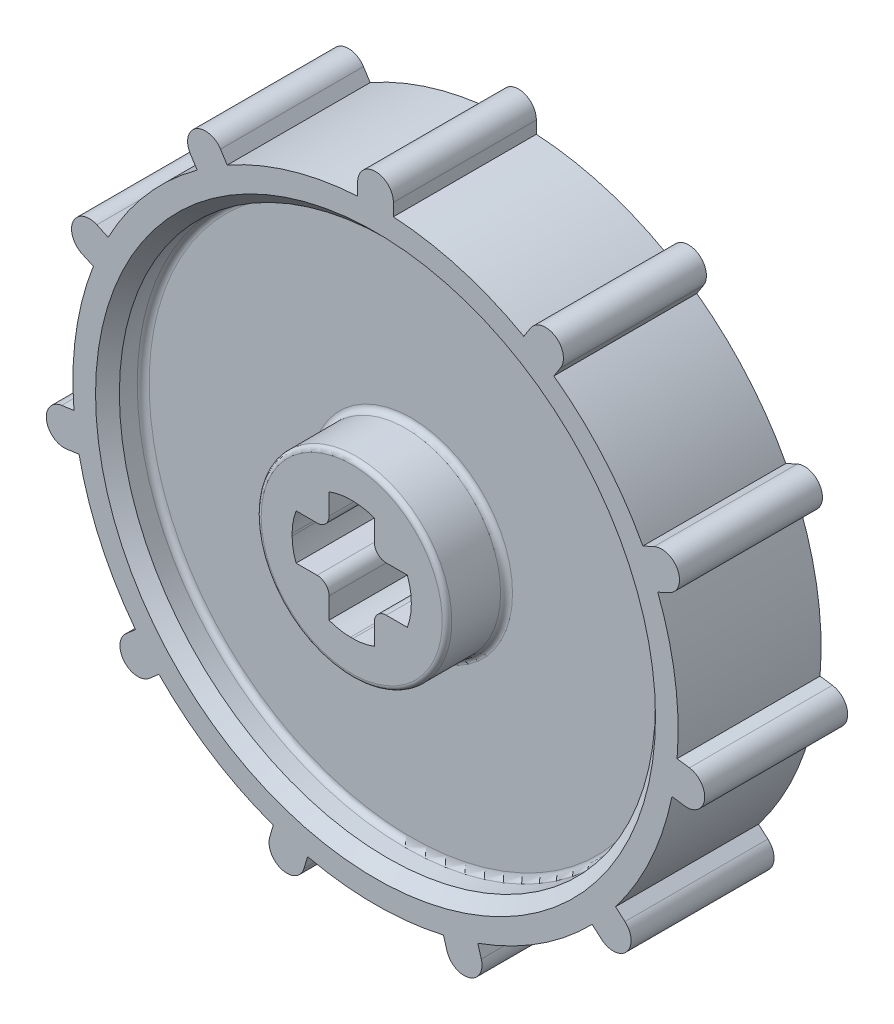
from build123d import *

# Parameters (mm, degrees)
BOSS_EXTRUDE1_DEPTH = 7
CIRPATTERN1_COUNT   = 11
CUT_EXTRUDE1_DEPTH  = 5
SKETCH4_R           = 11.25
SKETCH4_R_2         = 4
CUT_EXTRUDE2_DEPTH  = 2.5
CUT_EXTRUDE3_START  = -1
SKETCH6_R           = 11.25
CUT_EXTRUDE3_DEPTH  = 1
CHAMFER1_SIZE       = 0.5
FILLET1_R           = 0.25
FILLET2_R           = 0.2
CHAMFER2_SIZE       = 0.5
CHAMFER2_SIZE_2     = 1.866025404


with BuildPart() as part:
    # Sketch1 → Revolve1 (revolve)
    with BuildSketch(Plane(origin=(0, 0, 0), x_dir=(0, 0, -1), z_dir=(1, 0, 0)), mode=Mode.PRIVATE) as revolve1_sk:
        Polygon((0, 12.7), (7, 12.7), (7, 11.7), (6.5, 11.7), (6.5, 0), (0, 0), align=None)
    revolve(revolve1_sk.sketch.rotate(Axis((0, 0, 9.434023018), (0, 0, -1)), 90), axis=Axis((0, 0, 9.434023018), (0, 0, -1)))

    # Sketch2 → Boss-Extrude1 (add)
    with BuildSketch(Plane.XY):
        with BuildLine():
            Line((-0.75, 12.677834989), (-0.75, 13.2))
            ThreePointArc((-0.75, 13.2), (0, 13.95), (0.75, 13.2))
            Line((0.75, 13.2), (0.75, 12.677834989))
            ThreePointArc((0.75, 12.677834989), (0, 11.927834989), (-0.75, 12.677834989))
        make_face()
    boss_extrude1 = extrude(amount=-BOSS_EXTRUDE1_DEPTH)

    # CirPattern1: Boss-Extrude1 ×11 about axis
    cirpattern1_axis = Axis((0, 0, 0), (0, 0, 1))
    for i in range(1, CIRPATTERN1_COUNT):
        add(boss_extrude1.rotate(cirpattern1_axis, i * 360 / CIRPATTERN1_COUNT))

    # Sketch3 → Cut-Extrude1 (cut)
    with BuildSketch(Plane.XY):
        with BuildLine():
            Line((-0.95, 2.332380758), (-0.95, 1.45))
            ThreePointArc((-0.95, 1.45), (-1.096446609, 1.096446609), (-1.45, 0.95))
            Line((-1.45, 0.95), (-2.332380758, 0.95))
            ThreePointArc((-2.332380758, 0.95), (-2.457737974, 0.507737974), (-2.5, 0.05))
            Line((-2.5, 0.05), (-2.5, -0.05))
            ThreePointArc((-2.5, -0.05), (-2.457737974, -0.507737974), (-2.332380758, -0.95))
            Line((-2.332380758, -0.95), (-1.45, -0.95))
            ThreePointArc((-1.45, -0.95), (-1.096446609, -1.096446609), (-0.95, -1.45))
            Line((-0.95, -1.45), (-0.95, -2.332380758))
            ThreePointArc((-0.95, -2.332380758), (-0.507737974, -2.457737974), (-0.05, -2.5))
            Line((-0.05, -2.5), (0.05, -2.5))
            ThreePointArc((0.05, -2.5), (0.507737974, -2.457737974), (0.95, -2.332380758))
            Line((0.95, -2.332380758), (0.95, -1.45))
            ThreePointArc((0.95, -1.45), (1.096446609, -1.096446609), (1.45, -0.95))
            Line((1.45, -0.95), (2.332380758, -0.95))
            ThreePointArc((2.332380758, -0.95), (2.457737974, -0.507737974), (2.5, -0.05))
            Line((2.5, -0.05), (2.5, 0.05))
            ThreePointArc((2.5, 0.05), (2.457737974, 0.507737974), (2.332380758, 0.95))
            Line((2.332380758, 0.95), (1.45, 0.95))
            ThreePointArc((1.45, 0.95), (1.096446609, 1.096446609), (0.95, 1.45))
            Line((0.95, 1.45), (0.95, 2.332380758))
            ThreePointArc((0.95, 2.332380758), (0.507737974, 2.457737974), (0.05, 2.5))
            Line((0.05, 2.5), (-0.05, 2.5))
            ThreePointArc((-0.05, 2.5), (-0.507737974, 2.457737974), (-0.95, 2.332380758))
        make_face()
    extrude(amount=-CUT_EXTRUDE1_DEPTH, mode=Mode.SUBTRACT)

    # Sketch4 → Cut-Extrude2 (cut)
    with BuildSketch(Plane.XY):
        Circle(SKETCH4_R)
        Circle(SKETCH4_R_2, mode=Mode.SUBTRACT)
    extrude(amount=-CUT_EXTRUDE2_DEPTH, mode=Mode.SUBTRACT)

    # Sketch6 → Cut-Extrude3 (cut)
    with BuildSketch(Plane.XY.offset(CUT_EXTRUDE3_START)):
        with BuildLine():
            Line((-6.223214922, 11.070754086), (-6.505518641, 11.510027246))
            ThreePointArc((-6.505518641, 11.510027246), (-7.541939404, 11.735486783), (-7.76739894, 10.69906602))
            Line((-7.76739894, 10.69906602), (-7.485095221, 10.25979286))
            ThreePointArc((-7.485095221, 10.25979286), (-9.598019594, 8.316731321), (-11.220603078, 5.948786983))
            Line((-11.220603078, 5.948786983), (-11.695581079, 6.165702168))
            ThreePointArc((-11.695581079, 6.165702168), (-12.689366335, 5.795039431), (-12.318703598, 4.801254175))
            Line((-12.318703598, 4.801254175), (-11.843725597, 4.58433899))
            ThreePointArc((-11.843725597, 4.58433899), (-12.570732312, 1.807398446), (-12.655529037, -1.061877955))
            Line((-12.655529037, -1.061877955), (-13.172379162, -1.136189784))
            ThreePointArc((-13.172379162, -1.136189784), (-13.808009114, -1.985291994), (-12.958906904, -2.620921947))
            Line((-12.958906904, -2.620921947), (-12.44205678, -2.546610117))
            ThreePointArc((-12.44205678, -2.546610117), (-11.552326341, -5.275770665), (-10.072413947, -7.735404145))
            Line((-10.072413947, -7.735404145), (-10.467039932, -8.077349507))
            ThreePointArc((-10.467039932, -8.077349507), (-10.542706562, -9.135307239), (-9.484748831, -9.210973869))
            Line((-9.484748831, -9.210973869), (-9.090122846, -8.869028506))
            ThreePointArc((-9.090122846, -8.869028506), (-6.866138382, -10.683919867), (-4.291378597, -11.952994175))
            Line((-4.291378597, -11.952994175), (-4.438489481, -12.454007834))
            ThreePointArc((-4.438489481, -12.454007834), (-3.930169168, -13.384926982), (-2.99925002, -12.876606669))
            Line((-2.99925002, -12.876606669), (-2.852139136, -12.37559301))
            ThreePointArc((-2.852139136, -12.37559301), (0, -12.7), (2.852139136, -12.37559301))
            Line((2.852139136, -12.37559301), (2.99925002, -12.876606669))
            ThreePointArc((2.99925002, -12.876606669), (3.930169168, -13.384926982), (4.438489481, -12.454007834))
            Line((4.438489481, -12.454007834), (4.291378597, -11.952994175))
            ThreePointArc((4.291378597, -11.952994175), (6.866138382, -10.683919867), (9.090122846, -8.869028506))
            Line((9.090122846, -8.869028506), (9.484748831, -9.210973869))
            ThreePointArc((9.484748831, -9.210973869), (10.542706562, -9.135307239), (10.467039932, -8.077349507))
            Line((10.467039932, -8.077349507), (10.072413947, -7.735404145))
            ThreePointArc((10.072413947, -7.735404145), (11.552326341, -5.275770665), (12.44205678, -2.546610117))
            Line((12.44205678, -2.546610117), (12.958906904, -2.620921947))
            ThreePointArc((12.958906904, -2.620921947), (13.808009114, -1.985291994), (13.172379162, -1.136189784))
            Line((13.172379162, -1.136189784), (12.655529037, -1.061877955))
            ThreePointArc((12.655529037, -1.061877955), (12.570732312, 1.807398446), (11.843725597, 4.58433899))
            Line((11.843725597, 4.58433899), (12.318703598, 4.801254175))
            ThreePointArc((12.318703598, 4.801254175), (12.689366335, 5.795039431), (11.695581079, 6.165702168))
            Line((11.695581079, 6.165702168), (11.220603078, 5.948786983))
            ThreePointArc((11.220603078, 5.948786983), (9.598019594, 8.316731321), (7.485095221, 10.25979286))
            Line((7.485095221, 10.25979286), (7.76739894, 10.69906602))
            ThreePointArc((7.76739894, 10.69906602), (7.541939404, 11.735486783), (6.505518641, 11.510027246))
            Line((6.505518641, 11.510027246), (6.223214922, 11.070754086))
            ThreePointArc((6.223214922, 11.070754086), (3.578003472, 12.185560765), (0.75, 12.677834989))
            Line((0.75, 12.677834989), (0.75, 13.2))
            ThreePointArc((0.75, 13.2), (0, 13.95), (-0.75, 13.2))
            Line((-0.75, 13.2), (-0.75, 12.677834989))
            ThreePointArc((-0.75, 12.677834989), (-3.578003472, 12.185560765), (-6.223214922, 11.070754086))
        make_face()
        Circle(SKETCH6_R, mode=Mode.SUBTRACT)
    extrude(amount=CUT_EXTRUDE3_DEPTH, mode=Mode.SUBTRACT)

    # Chamfer1
    chamfer1_edges = [part.edges().sort_by_distance(p)[0] for p in [
        (-11.25, 0, -1),
    ]]
    chamfer(chamfer1_edges, length=CHAMFER1_SIZE)

    # Fillet1
    fillet1_edges = [part.edges().sort_by_distance(p)[0] for p in [
        (-11.25, 0, -2.5),
        (-4, 0, -2.5),
    ]]
    fillet(fillet1_edges, radius=FILLET1_R)

    # Fillet2
    fillet2_edges = [part.edges().sort_by_distance(p)[0] for p in [
        (-4, 0, 0),
    ]]
    fillet(fillet2_edges, radius=FILLET2_R)

    # Chamfer2
    # the kernel refuses this chamfer: 1.866025404, 0.5 mm, written as the material it adds along each edge
    with BuildSketch(Plane(origin=(0, 0, -6.5), x_dir=(1, 0, 0), z_dir=(0, 1, 0))) as chamfer2_piece_1_section:
        Polygon((11.7, CHAMFER2_SIZE), (11.7 - CHAMFER2_SIZE_2, 0), (11.7, 0), align=None)
    chamfer2_piece_1 = revolve(axis=Axis((0, 0, -6.5), (0, 0, -1)), mode=Mode.PRIVATE)
    chamfer2_piece_1 = split(chamfer2_piece_1, bisect_by=Plane(origin=(-10.739750949, 0, -7), z_dir=(0, 0, 1)), keep=Keep.TOP, mode=Mode.PRIVATE)
    add(chamfer2_piece_1)


solid = part.part
